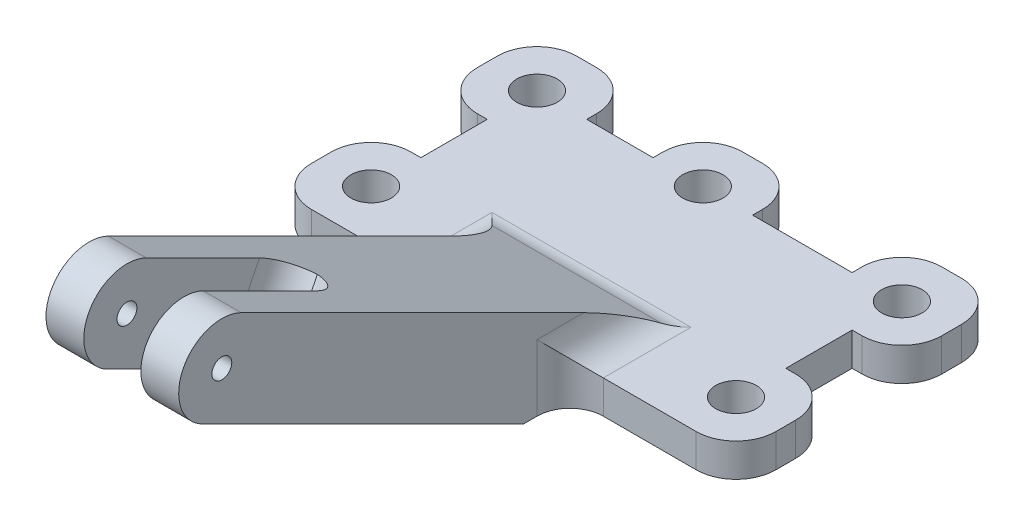
from build123d import *

# Parameters (mm, degrees)
SKETCH1_R           = 1.5
BOSS_EXTRUDE1_DEPTH = 20
SKETCH2_W           = 8.6
SKETCH2_H           = 36.312939462
CUT_EXTRUDE1_DEPTH  = 20
FILLET2_R           = 5
SKETCH3_R           = 3.05
BOSS_EXTRUDE3_DEPTH = 5
FILLET3_R           = 5
FILLET4_R           = 5


with BuildPart() as part:
    # Sketch1 → Boss-Extrude1 (new body)
    with BuildSketch(Plane(origin=(0, 0, 0), x_dir=(0, 0, -1), z_dir=(1, 0, 0))):
        with BuildLine():
            Line((2.906888371, 35.813776741), (74.534441854, 0))
            Line((74.534441854, 0), (45.465558146, 0))
            Line((45.465558146, 0), (-2.906888371, 24.186223259))
            ThreePointArc((-2.906888371, 24.186223259), (-5.813776741, 32.906888371), (2.906888371, 35.813776741))
        make_face()
        with Locations((0, 30)):
            Circle(SKETCH1_R, mode=Mode.SUBTRACT)
    extrude(amount=BOSS_EXTRUDE1_DEPTH)

    # Sketch2 → Cut-Extrude1 (cut)
    with BuildSketch(Plane(origin=(0, 29.813776741, -14.906888371), x_dir=(1, 0, 0), z_dir=(0, 0.894427190999916, -0.4472135954999577))):
        with Locations((10, -7.492276671)):
            Rectangle(SKETCH2_W, SKETCH2_H)
    extrude(amount=-CUT_EXTRUDE1_DEPTH, mode=Mode.SUBTRACT)

    # Fillet2
    # the kernel refuses this fillet: 5 mm, written as the material it adds along each edge
    with BuildSketch(Plane(origin=(5.7, 25.04460462, -24.445232613), x_dir=(1, 0, 0), z_dir=(0, -0.894427190999916, 0.4472135954999577)), Plane(origin=(14.3, 25.04460462, -24.445232613), x_dir=(0, 0.44721359549995776, 0.894427190999916), z_dir=(0, -0.894427190999916, 0.4472135954999577))) as fillet2_piece_1:
        with BuildLine():
            CenterArc((FILLET2_R, FILLET2_R), FILLET2_R, 180, 90)
            Line((0, FILLET2_R), (0, 0))
            Line((0, 0), (FILLET2_R, 0))
        make_face()
    extrude(amount=13)

    # Sketch3 → Boss-Extrude3 (add)
    with BuildSketch(Plane.XZ):
        with BuildLine():
            Line((-19, -92.5), (-16, -92.5))
            ThreePointArc((-16, -92.5), (-11.757359313, -90.742640687), (-10, -86.5))
            Line((-10, -86.5), (-10, -85))
            Line((-10, -85), (0, -85))
            Line((0, -85), (0, -86.5))
            ThreePointArc((0, -86.5), (1.757359313, -90.742640687), (6, -92.5))
            Line((6, -92.5), (9, -92.5))
            ThreePointArc((9, -92.5), (13.242640687, -90.742640687), (15, -86.5))
            Line((15, -86.5), (15, -85))
            Line((15, -85), (30, -85))
            Line((30, -85), (30, -86.5))
            ThreePointArc((30, -86.5), (31.757359313, -90.742640687), (36, -92.5))
            Line((36, -92.5), (39, -92.5))
            ThreePointArc((39, -92.5), (43.242640687, -90.742640687), (45, -86.5))
            Line((45, -86.5), (45, -83.5))
            ThreePointArc((45, -83.5), (43.242640687, -79.257359313), (39, -77.5))
            Line((39, -77.5), (37.5, -77.5))
            Line((37.5, -77.5), (37.5, -67.5))
            Line((37.5, -67.5), (39, -67.5))
            ThreePointArc((39, -67.5), (43.242640687, -65.742640687), (45, -61.5))
            Line((45, -61.5), (45, -58.5))
            ThreePointArc((45, -58.5), (43.242640687, -54.257359313), (39, -52.5))
            Line((39, -52.5), (37.5, -52.5))
            Line((37.5, -52.5), (-17.5, -52.5))
            Line((-17.5, -52.5), (-19, -52.5))
            ThreePointArc((-19, -52.5), (-23.242640687, -54.257359313), (-25, -58.5))
            Line((-25, -58.5), (-25, -61.5))
            ThreePointArc((-25, -61.5), (-23.242640687, -65.742640687), (-19, -67.5))
            Line((-19, -67.5), (-17.5, -67.5))
            Line((-17.5, -67.5), (-17.5, -77.5))
            Line((-17.5, -77.5), (-19, -77.5))
            ThreePointArc((-19, -77.5), (-23.242640687, -79.257359313), (-25, -83.5))
            Line((-25, -83.5), (-25, -86.5))
            ThreePointArc((-25, -86.5), (-23.242640687, -90.742640687), (-19, -92.5))
        make_face()
        with Locations(Location((-17.5, -85, 0), (0, 0, 270))):
            Circle(SKETCH3_R, mode=Mode.SUBTRACT)
        with Locations(Location((7.5, -85, 0), (0, 0, 270))):
            Circle(SKETCH3_R, mode=Mode.SUBTRACT)
        with Locations(Location((37.5, -85, 0), (0, 0, 270))):
            Circle(SKETCH3_R, mode=Mode.SUBTRACT)
        with Locations(Location((-17.5, -60, 0), (0, 0, 270))):
            Circle(SKETCH3_R, mode=Mode.SUBTRACT)
        with Locations(Location((37.5, -60, 0), (0, 0, 270))):
            Circle(SKETCH3_R, mode=Mode.SUBTRACT)
    extrude(amount=-BOSS_EXTRUDE3_DEPTH)

    # Fillet3
    fillet3_edges = [part.edges().sort_by_distance(p)[0] for p in [
        (10, 5, -64.534441854),
        (20, 5, -58.517220927),
        (0, 5, -58.517220927),
    ]]
    fillet(fillet3_edges, radius=FILLET3_R)

    # Fillet4
    fillet4_edges = [part.edges().sort_by_distance(p)[0] for p in [
        (0, 5, -52.5),
        (20, 5, -52.5),
    ]]
    fillet(fillet4_edges, radius=FILLET4_R)


solid = part.part
